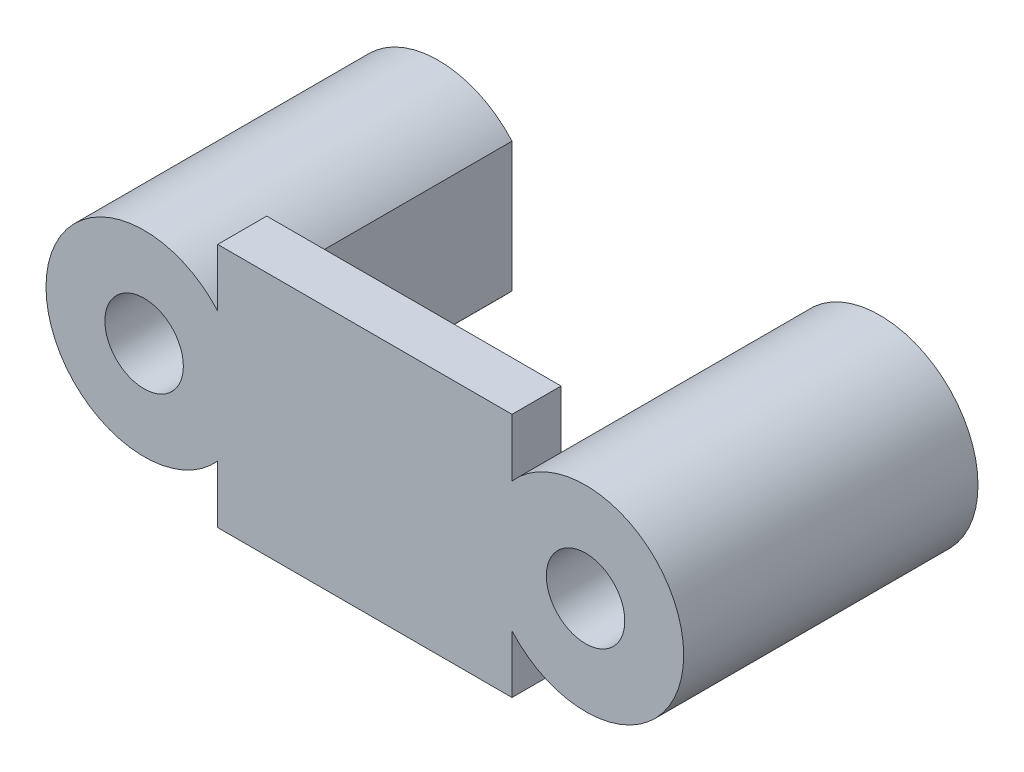
from build123d import *

# Parameters (mm, degrees)
SKIZZE2_R                            = 1.6
AUFSATZ_LINEAR_AUSTRAGEN1_DEPTH      = 12
SCHNITT_LINEAR_AUSTRAGEN1_DEPTH      = 19.384776311
SCHNITT_LINEAR_AUSTRAGEN1_DEPTH_BACK = 19.384776311
SKIZZE3_W                            = 12
SKIZZE3_H                            = 10


with BuildPart() as part:
    # Skizze2 → Aufsatz-Linear austragen1 (new body)
    with BuildSketch(Plane.XY):
        with BuildLine():
            Line((-6, -2.645751311), (-6, -5))
            Line((-6, -5), (6, -5))
            Line((6, -5), (6, -2.645751311))
            ThreePointArc((6, -2.645751311), (13, 0), (6, 2.645751311))
            Line((6, 2.645751311), (6, 5))
            Line((6, 5), (-6, 5))
            Line((-6, 5), (-6, 2.645751311))
            ThreePointArc((-6, 2.645751311), (-13, 0), (-6, -2.645751311))
        make_face()
        with Locations((-9, 0)):
            Circle(SKIZZE2_R, mode=Mode.SUBTRACT)
        with Locations((9, 0)):
            Circle(SKIZZE2_R, mode=Mode.SUBTRACT)
    extrude(amount=AUFSATZ_LINEAR_AUSTRAGEN1_DEPTH)

    # Skizze3 → Schnitt-Linear austragen1 (cut, two sides: drawn at the far end of the back side and taken through both)
    with BuildSketch(Plane(origin=(0, 0, 0), x_dir=(-1, 0, 0), z_dir=(0, -1, 0)).offset(-SCHNITT_LINEAR_AUSTRAGEN1_DEPTH_BACK)):
        with Locations((0, -5)):
            Rectangle(SKIZZE3_W, SKIZZE3_H)
    extrude(amount=SCHNITT_LINEAR_AUSTRAGEN1_DEPTH + SCHNITT_LINEAR_AUSTRAGEN1_DEPTH_BACK, mode=Mode.SUBTRACT)


solid = part.part
